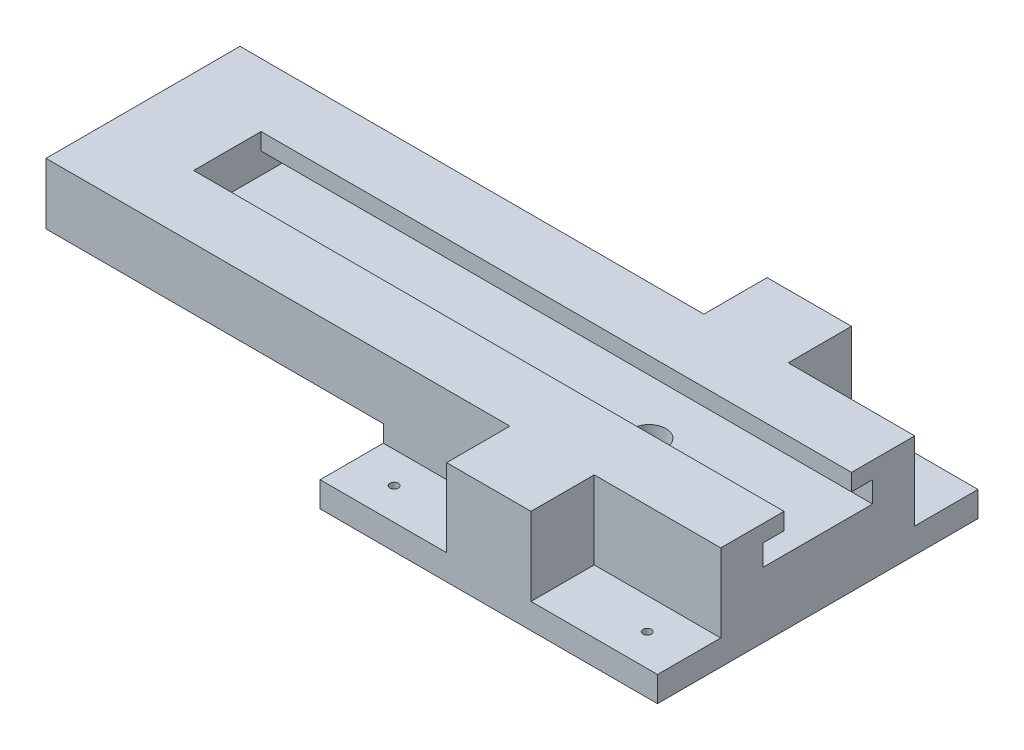
from build123d import *

# Parameters (mm, degrees)
BOSS_EXTRUDE1_DEPTH = 4
BOSS_EXTRUDE2_DEPTH = 5
BOSS_EXTRUDE3_START = -5
SKETCH3_W           = 160
SKETCH3_H           = 76
BOSS_EXTRUDE3_DEPTH = 5.5
BOSS_EXTRUDE4_START = -10.5
SKETCH4_W           = 80
SKETCH4_H           = 76
BOSS_EXTRUDE4_DEPTH = 10
BOSS_EXTRUDE7_START = -20.5
SKETCH17_R          = 19
BOSS_EXTRUDE7_DEPTH = 8
CUT_EXTRUDE1_START  = -25
SKETCH5_R           = 10.5
CUT_EXTRUDE1_DEPTH  = 12
CUT_EXTRUDE2_START  = -4
SKETCH7_R           = 1.5
CUT_EXTRUDE2_DEPTH  = 25
CUT_EXTRUDE3_START  = -5
SKETCH8_R           = 4
CUT_EXTRUDE3_DEPTH  = 18.5
CUT_EXTRUDE5_START  = 4
SKETCH18_W          = 110
SKETCH18_H          = 15
SKETCH18_W_2        = 30
CUT_EXTRUDE5_DEPTH  = 18.5
CUT_EXTRUDE6_START  = 4
SKETCH9_R           = 1
CUT_EXTRUDE6_DEPTH  = 40


with BuildPart() as part:
    # Sketch1 → Boss-Extrude1 (new body)
    with BuildSketch(Plane(origin=(0, 0, 0), x_dir=(1, 0, 0), z_dir=(0, 1, 0))):
        Polygon((80, -16), (220, -16), (220, -46), (60, -46), (60, 30), (220, 30), (220, 0), (80, 0), align=None)
    extrude(amount=BOSS_EXTRUDE1_DEPTH)

    # Sketch2 → Boss-Extrude2 (add)
    with BuildSketch(Plane(origin=(0, 0, 0), x_dir=(1, 0, 0), z_dir=(0, 1, 0))):
        Polygon((220, 5), (220, 30), (60, 30), (60, -46), (220, -46), (220, -21), (80, -21), (80, 5), align=None)
    extrude(amount=-BOSS_EXTRUDE2_DEPTH)

    # Sketch3 → Boss-Extrude3 (add)
    with BuildSketch(Plane(origin=(0, 0, 0), x_dir=(1, 0, 0), z_dir=(0, 1, 0)).offset(BOSS_EXTRUDE3_START)):
        with Locations((140, -8)):
            Rectangle(SKETCH3_W, SKETCH3_H)
    extrude(amount=-BOSS_EXTRUDE3_DEPTH)

    # Sketch4 → Boss-Extrude4 (add)
    with BuildSketch(Plane(origin=(0, 0, 0), x_dir=(1, 0, 0), z_dir=(0, 1, 0)).offset(BOSS_EXTRUDE4_START)):
        with Locations((180, -8)):
            Rectangle(SKETCH4_W, SKETCH4_H)
    extrude(amount=-BOSS_EXTRUDE4_DEPTH)

    # Sketch17 → Boss-Extrude7 (add)
    with BuildSketch(Plane(origin=(0, 0, 0), x_dir=(1, 0, 0), z_dir=(0, 1, 0)).offset(BOSS_EXTRUDE7_START)):
        with Locations((180, -8)):
            Circle(SKETCH17_R)
    extrude(amount=-BOSS_EXTRUDE7_DEPTH)

    # Sketch5 → Cut-Extrude1 (cut)
    with BuildSketch(Plane(origin=(0, 0, 0), x_dir=(1, 0, 0), z_dir=(0, 1, 0)).offset(CUT_EXTRUDE1_START)):
        with Locations((180, -8)):
            Circle(SKETCH5_R)
    extrude(amount=-CUT_EXTRUDE1_DEPTH, mode=Mode.SUBTRACT)

    # Sketch7 → Cut-Extrude2 (cut)
    with BuildSketch(Plane(origin=(0, 0, 0), x_dir=(1, 0, 0), z_dir=(0, 1, 0)).offset(CUT_EXTRUDE2_START)):
        with Locations((180, -8)):
            Circle(SKETCH7_R)
    extrude(amount=-CUT_EXTRUDE2_DEPTH, mode=Mode.SUBTRACT)

    # Sketch8 → Cut-Extrude3 (cut)
    with BuildSketch(Plane(origin=(0, 0, 0), x_dir=(1, 0, 0), z_dir=(0, 1, 0)).offset(CUT_EXTRUDE3_START)):
        with Locations((180, -8)):
            Circle(SKETCH8_R)
    extrude(amount=-CUT_EXTRUDE3_DEPTH, mode=Mode.SUBTRACT)

    # Sketch18 → Cut-Extrude5 (cut)
    with BuildSketch(Plane(origin=(0, 0, 0), x_dir=(1, 0, 0), z_dir=(0, 1, 0)).offset(CUT_EXTRUDE5_START)):
        with Locations((115, 22.5)):
            Rectangle(SKETCH18_W, SKETCH18_H)
        with Locations((115, -38.5)):
            Rectangle(SKETCH18_W, SKETCH18_H)
        with Locations((205, 22.5)):
            Rectangle(SKETCH18_W_2, SKETCH18_H)
        with Locations((205, -38.5)):
            Rectangle(SKETCH18_W_2, SKETCH18_H)
    extrude(amount=-CUT_EXTRUDE5_DEPTH, mode=Mode.SUBTRACT)

    # Sketch9 → Cut-Extrude6 (cut)
    with BuildSketch(Plane(origin=(0, 0, 0), x_dir=(1, 0, 0), z_dir=(0, 1, 0)).offset(CUT_EXTRUDE6_START)):
        with Locations((150, 22.45)):
            Circle(SKETCH9_R)
        with Locations((150, -38.45)):
            Circle(SKETCH9_R)
        with Locations((210, 22.45)):
            Circle(SKETCH9_R)
        with Locations((210, -38.45)):
            Circle(SKETCH9_R)
    extrude(amount=-CUT_EXTRUDE6_DEPTH, mode=Mode.SUBTRACT)


solid = part.part
